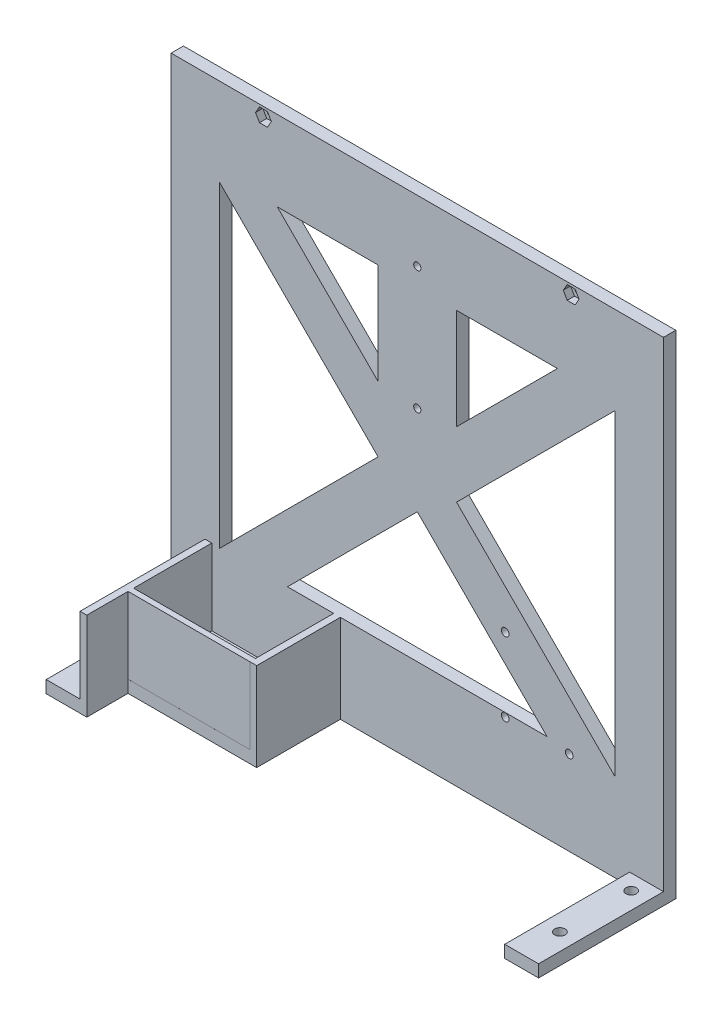
from build123d import *

# Parameters (mm, degrees)
SKETCH1_W           = 203.2
SKETCH1_H           = 203.2
SKETCH1_R           = 1.5
BOSS_EXTRUDE1_DEPTH = 5.08
SKETCH2_W           = 13.97
SKETCH2_H           = 5.08
BOSS_EXTRUDE2_DEPTH = 51.562
CUT_EXTRUDE1_REACH  = 231.744
SKETCH3_R           = 2.159
CUT_EXTRUDE2_REACH  = 154.656
SKETCH7_R           = 1.5875
BOSS_EXTRUDE6_REACH = 181.07
SKETCH8_W           = 2.3
SKETCH8_H           = 31.385365186
SKETCH10_W          = 17.01
SKETCH10_H          = 36.465365186
CUT_EXTRUDE3_DEPTH  = 53.09
CUT_EXTRUDE4_START  = -3
SKETCH11_R          = 1.5
CUT_EXTRUDE4_DEPTH  = 3


with BuildPart() as part:
    # Sketch1 → Boss-Extrude1 (new body)
    with BuildSketch(Plane.XY):
        Rectangle(SKETCH1_W, SKETCH1_H)
        Polygon((53.588290096, -65.134634814), (-53.588290096, -65.134634814), (0, -11.546344718), align=None, mode=Mode.SUBTRACT)
        Polygon((-81.543221181, -65.354531679), (-81.543221181, 65.354531679), (-16.188689502, 0), align=None, mode=Mode.SUBTRACT)
        Polygon((81.543221181, -65.354531679), (16.188689502, 0), (81.543221181, 65.354531679), align=None, mode=Mode.SUBTRACT)
        Polygon((-57.815177682, 68.567256543), (-16.188689502, 68.567256543), (-16.188689502, 26.940768363), align=None, mode=Mode.SUBTRACT)
        with Locations((0, 25.4)):
            Circle(SKETCH1_R, mode=Mode.SUBTRACT)
        with Locations((-63.5, 97.79)):
            Circle(SKETCH1_R, mode=Mode.SUBTRACT)
        with Locations((0, 76.2)):
            Circle(SKETCH1_R, mode=Mode.SUBTRACT)
        Polygon((57.815177682, 68.567256543), (16.188689502, 26.940768363), (16.188689502, 68.567256543), align=None, mode=Mode.SUBTRACT)
        with Locations((63.5, 97.79)):
            Circle(SKETCH1_R, mode=Mode.SUBTRACT)
    extrude(amount=BOSS_EXTRUDE1_DEPTH)

    # Sketch2 → Boss-Extrude2 (add)
    with BuildSketch(Plane.XY.offset(5.08)):
        Polygon((-101.6, -96.52), (-101.6, -101.6), (-31.75, -101.6), (-31.75, -65.134634814), (-34.544, -65.134634814), (-34.544, -96.52), (-84.836, -96.52), (-84.836, -65.134634814), (-87.63, -65.134634814), (-87.63, -96.52), align=None)
        with Locations((94.615, -99.06)):
            Rectangle(SKETCH2_W, SKETCH2_H)
    extrude(amount=BOSS_EXTRUDE2_DEPTH)

    # Sketch3 → Cut-Extrude1 (cut, up to next)
    with BuildSketch(Plane(origin=(0, -96.52, 0), x_dir=(1, 0, 0), z_dir=(0, 1, 0)), mode=Mode.PRIVATE) as cut_extrude1_sk1:
        with Locations((-94.615, -11.43)):
            Circle(SKETCH3_R)
    cut_extrude1_tool1 = extrude(cut_extrude1_sk1.sketch, amount=-CUT_EXTRUDE1_REACH, mode=Mode.PRIVATE) & part.part
    # Sketch3 → Cut-Extrude1 (cut, up to next)
    with BuildSketch(Plane(origin=(0, -96.52, 0), x_dir=(1, 0, 0), z_dir=(0, 1, 0)), mode=Mode.PRIVATE) as cut_extrude1_sk2:
        with Locations((94.615, -11.43)):
            Circle(SKETCH3_R)
    cut_extrude1_tool2 = extrude(cut_extrude1_sk2.sketch, amount=-CUT_EXTRUDE1_REACH, mode=Mode.PRIVATE) & part.part
    # Sketch3 → Cut-Extrude1 (cut, up to next)
    with BuildSketch(Plane(origin=(0, -96.52, 0), x_dir=(1, 0, 0), z_dir=(0, 1, 0)), mode=Mode.PRIVATE) as cut_extrude1_sk3:
        with Locations((-94.615, -40.84)):
            Circle(SKETCH3_R)
    cut_extrude1_tool3 = extrude(cut_extrude1_sk3.sketch, amount=-CUT_EXTRUDE1_REACH, mode=Mode.PRIVATE) & part.part
    # Sketch3 → Cut-Extrude1 (cut, up to next)
    with BuildSketch(Plane(origin=(0, -96.52, 0), x_dir=(1, 0, 0), z_dir=(0, 1, 0)), mode=Mode.PRIVATE) as cut_extrude1_sk4:
        with Locations((94.615, -40.84)):
            Circle(SKETCH3_R)
    cut_extrude1_tool4 = extrude(cut_extrude1_sk4.sketch, amount=-CUT_EXTRUDE1_REACH, mode=Mode.PRIVATE) & part.part
    add(cut_extrude1_tool1.solids().sort_by_distance((-94.615, -96.52, 11.43))[0], mode=Mode.SUBTRACT)
    add(cut_extrude1_tool2.solids().sort_by_distance((94.615, -96.52, 11.43))[0], mode=Mode.SUBTRACT)
    add(cut_extrude1_tool3.solids().sort_by_distance((-94.615, -96.52, 40.84))[0], mode=Mode.SUBTRACT)
    add(cut_extrude1_tool4.solids().sort_by_distance((94.615, -96.52, 40.84))[0], mode=Mode.SUBTRACT)

    # Sketch7 → Cut-Extrude2 (cut, up to next)
    with BuildSketch(Plane.XY.offset(5.08), mode=Mode.PRIVATE) as cut_extrude2_sk1:
        with Locations((36.287585831, -66.785318729)):
            Circle(SKETCH7_R)
    cut_extrude2_tool1 = extrude(cut_extrude2_sk1.sketch, amount=-CUT_EXTRUDE2_REACH, mode=Mode.PRIVATE) & part.part
    # Sketch7 → Cut-Extrude2 (cut, up to next)
    with BuildSketch(Plane.XY.offset(5.08), mode=Mode.PRIVATE) as cut_extrude2_sk2:
        with Locations((36.287585831, -36.432318729)):
            Circle(SKETCH7_R)
    cut_extrude2_tool2 = extrude(cut_extrude2_sk2.sketch, amount=-CUT_EXTRUDE2_REACH, mode=Mode.PRIVATE) & part.part
    # Sketch7 → Cut-Extrude2 (cut, up to next)
    with BuildSketch(Plane.XY.offset(5.08), mode=Mode.PRIVATE) as cut_extrude2_sk3:
        with Locations((62.703585831, -66.785318729)):
            Circle(SKETCH7_R)
    cut_extrude2_tool3 = extrude(cut_extrude2_sk3.sketch, amount=-CUT_EXTRUDE2_REACH, mode=Mode.PRIVATE) & part.part
    add(cut_extrude2_tool1.solids().sort_by_distance((36.287586, -66.785319, 5.08))[0], mode=Mode.SUBTRACT)
    add(cut_extrude2_tool2.solids().sort_by_distance((36.287586, -36.432319, 5.08))[0], mode=Mode.SUBTRACT)
    add(cut_extrude2_tool3.solids().sort_by_distance((62.703586, -66.785319, 5.08))[0], mode=Mode.SUBTRACT)

    # Sketch8 → Boss-Extrude6 (add, up to next)
    with BuildSketch(Plane.ZY.offset(34.544), mode=Mode.PRIVATE) as boss_extrude6_sk1:
        with Locations((38.48, -80.827317407)):
            Rectangle(SKETCH8_W, SKETCH8_H)
    boss_extrude6_tool1 = extrude(boss_extrude6_sk1.sketch, amount=BOSS_EXTRUDE6_REACH, mode=Mode.PRIVATE) - part.part
    add(boss_extrude6_tool1.solids().sort_by_distance((-34.544, -80.827317, 38.48))[0])

    # Sketch10 → Cut-Extrude3 (cut)
    with BuildSketch(Plane(origin=(-31.75, 0, 0), x_dir=(0, 0, -1), z_dir=(1, 0, 0))):
        with Locations((-48.137, -83.367317407)):
            Rectangle(SKETCH10_W, SKETCH10_H)
    extrude(amount=-CUT_EXTRUDE3_DEPTH, mode=Mode.SUBTRACT)

    # Sketch11 → Cut-Extrude4 (cut)
    # profile 1 of 2: a face of its own
    with BuildSketch(Plane.XY.offset(5.08).offset(CUT_EXTRUDE4_START)):
        Polygon((-65.13101451, 94.965), (-61.86898549, 94.965), (-60.237970979, 97.79), (-61.86898549, 100.615), (-65.13101451, 100.615), (-66.762029021, 97.79), align=None)
        with Locations((-63.5, 97.79)):
            Circle(SKETCH11_R, mode=Mode.SUBTRACT)
    # profile 2 of 2: a face of its own
    with BuildSketch(Plane.XY.offset(5.08).offset(CUT_EXTRUDE4_START)):
        Polygon((61.86898549, 94.965), (65.13101451, 94.965), (66.762029021, 97.79), (65.13101451, 100.615), (61.86898549, 100.615), (60.237970979, 97.79), align=None)
        with Locations((63.5, 97.79)):
            Circle(SKETCH11_R, mode=Mode.SUBTRACT)
    extrude(amount=CUT_EXTRUDE4_DEPTH, mode=Mode.SUBTRACT)


solid = part.part
